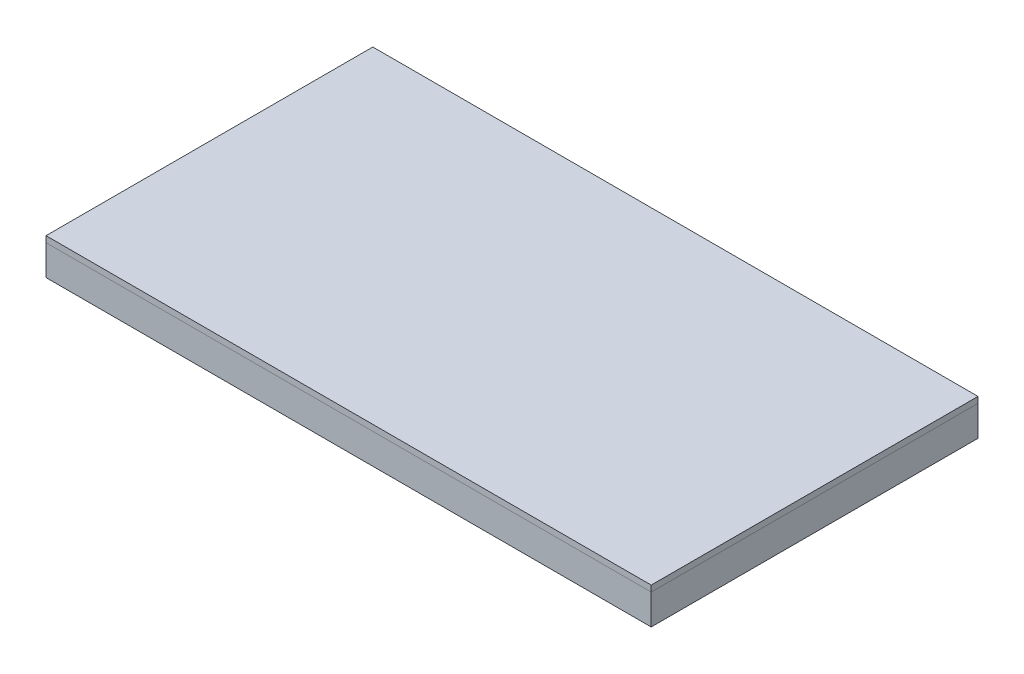
from build123d import *

# Parameters (mm, degrees)
SKETCH1_W           = 1000
SKETCH1_H           = 540
BOSS_EXTRUDE1_DEPTH = 10
SKETCH1_3_W         = 1000
SKETCH1_3_H         = 540
SKETCH1_3_W_2       = 980
SKETCH1_3_H_2       = 520
BOSS_EXTRUDE2_DEPTH = 50


with BuildPart() as part:
    # Sketch1 → Boss-Extrude1 (new body)
    with BuildSketch(Plane(origin=(0, 0, 0), x_dir=(1, 0, 0), z_dir=(0, 1, 0))):
        Rectangle(SKETCH1_W, SKETCH1_H)
    extrude(amount=BOSS_EXTRUDE1_DEPTH)


with BuildPart() as body_2:
    # Sketch1<3> → Boss-Extrude2 (new body)
    with BuildSketch(Plane(origin=(0, 0, 0), x_dir=(1, 0, 0), z_dir=(0, 1, 0))):
        Rectangle(SKETCH1_3_W, SKETCH1_3_H)
        Rectangle(SKETCH1_3_W_2, SKETCH1_3_H_2, mode=Mode.SUBTRACT)
    extrude(amount=-BOSS_EXTRUDE2_DEPTH)


solid = Compound([part.part, body_2.part])
